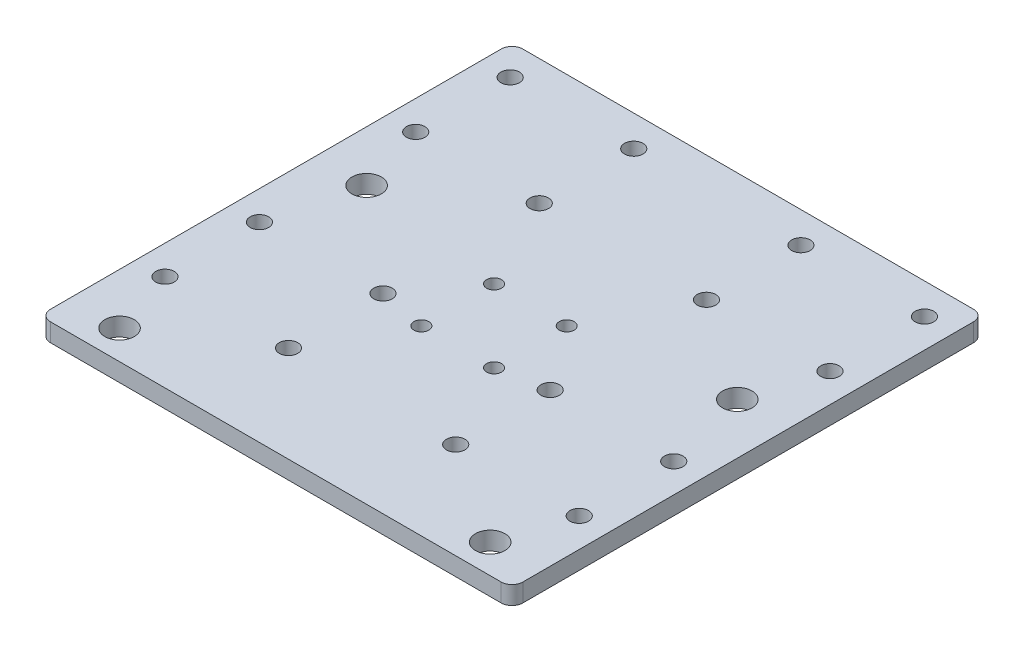
from build123d import *

# Parameters (mm, degrees)
SKETCH1_W           = 130
SKETCH1_H           = 130
BOSS_EXTRUDE1_DEPTH = 5
SKETCH2_R           = 4.05
CUT_EXTRUDE1_DEPTH  = 10
FILLET1_START       = -1
FILLET1_OUTLINE_R   = 2.55
FILLET1_OUTLINE_R_2 = 2.05
FILLET1_DEPTH       = 7


with BuildPart() as part:
    # Sketch1 → Boss-Extrude1 (new body)
    with BuildSketch(Plane(origin=(0, 0, 0), x_dir=(1, 0, 0), z_dir=(0, 1, 0))):
        with Locations((65, -65)):
            Rectangle(SKETCH1_W, SKETCH1_H)
    extrude(amount=BOSS_EXTRUDE1_DEPTH)

    # Sketch2 → Cut-Extrude1 (cut)
    with BuildSketch(Plane(origin=(0, 5, 0), x_dir=(1, 0, 0), z_dir=(0, 1, 0))):
        with Locations(Location((14, -54, 0), (0, 0, 270))):
            Circle(SKETCH2_R)
        with Locations(Location((116, -54, 0), (0, 0, 270))):
            Circle(SKETCH2_R)
        with Locations(Location((116, -122, 0), (0, 0, 270))):
            Circle(SKETCH2_R)
        with Locations(Location((14, -122, 0), (0, 0, 270))):
            Circle(SKETCH2_R)
    extrude(amount=-CUT_EXTRUDE1_DEPTH, mode=Mode.SUBTRACT)

    # Fillet1: read off the stored shape, not the designer's step
    # Fillet1 outline → Fillet1 (cut)
    with BuildSketch(Plane(origin=(0, 0, 0), x_dir=(1, 0, 0), z_dir=(0, 1, 0)).offset(FILLET1_START)):
        with Locations((41.997459274, -8.5)):
            Circle(FILLET1_OUTLINE_R)
        with Locations((41.997459274, -77.5)):
            Circle(FILLET1_OUTLINE_R)
        with Locations((41.997459274, -103.5)):
            Circle(FILLET1_OUTLINE_R)
        with Locations((7.997459274, -103.5)):
            Circle(FILLET1_OUTLINE_R)
        with Locations((88.002540726, -77.5)):
            Circle(FILLET1_OUTLINE_R)
        with Locations((88.002540726, -103.5)):
            Circle(FILLET1_OUTLINE_R)
        with Locations((41.997459274, -34.5)):
            Circle(FILLET1_OUTLINE_R)
        with Locations((7.997459274, -8.5)):
            Circle(FILLET1_OUTLINE_R)
        with Locations((7.997459274, -34.5)):
            Circle(FILLET1_OUTLINE_R)
        with Locations((7.997459274, -77.5)):
            Circle(FILLET1_OUTLINE_R)
        with Locations((88.002540726, -8.5)):
            Circle(FILLET1_OUTLINE_R)
        with Locations((55, -59.941575486)):
            Circle(FILLET1_OUTLINE_R_2)
        with Locations((75, -59.941575486)):
            Circle(FILLET1_OUTLINE_R_2)
        with Locations((75, -79.941575486)):
            Circle(FILLET1_OUTLINE_R_2)
        with Locations((55, -79.941575486)):
            Circle(FILLET1_OUTLINE_R_2)
        with Locations((88.002540726, -34.5)):
            Circle(FILLET1_OUTLINE_R)
        with Locations((122.002540726, -34.5)):
            Circle(FILLET1_OUTLINE_R)
        with Locations((122.002540726, -8.5)):
            Circle(FILLET1_OUTLINE_R)
        with Locations((122.002540726, -77.5)):
            Circle(FILLET1_OUTLINE_R)
        with Locations((122.002540726, -103.5)):
            Circle(FILLET1_OUTLINE_R)
        with BuildLine():
            Line((130, -130), (130, -127))
            ThreePointArc((130, -127), (129.121320344, -129.121320344), (127, -130))
            Line((127, -130), (130, -130))
        make_face()
        with BuildLine():
            ThreePointArc((127, 0), (129.121320344, -0.878679656), (130, -3))
            Line((130, -3), (130, 0))
            Line((130, 0), (127, 0))
        make_face()
        with BuildLine():
            Line((0, -130), (3, -130))
            ThreePointArc((3, -130), (0.878679656, -129.121320344), (0, -127))
            Line((0, -127), (0, -130))
        make_face()
        with BuildLine():
            ThreePointArc((0, -3), (0.878679656, -0.878679656), (3, 0))
            Line((3, 0), (0, 0))
            Line((0, 0), (0, -3))
        make_face()
    extrude(amount=FILLET1_DEPTH, mode=Mode.SUBTRACT)


solid = part.part
